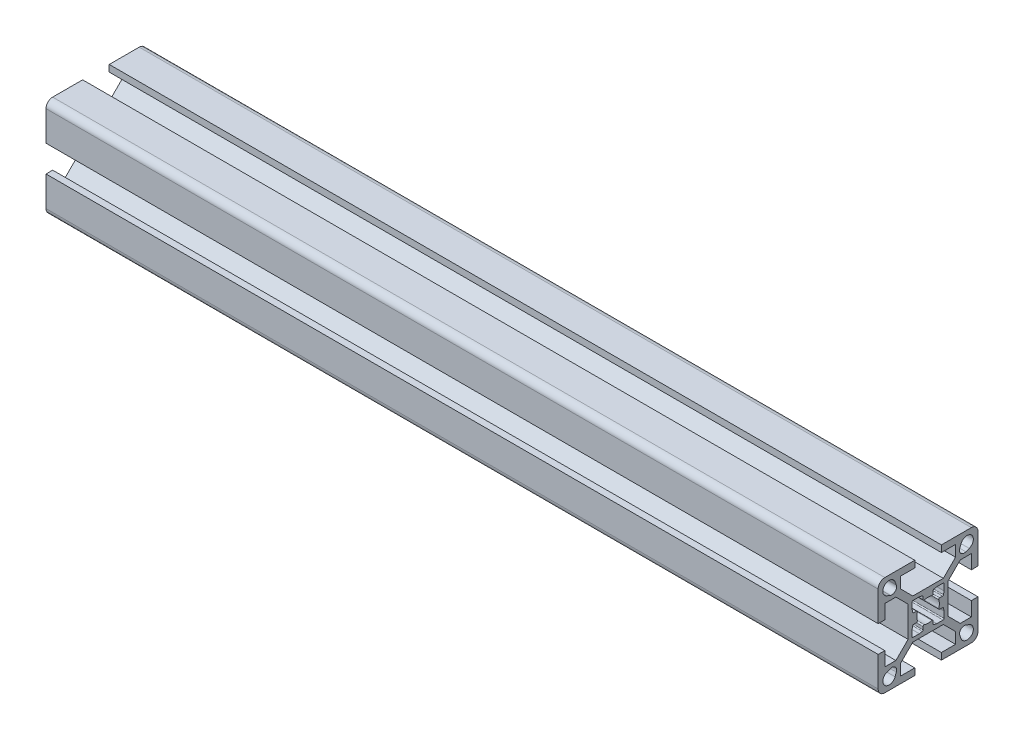
from build123d import *

# Parameters (mm, degrees)
BOSS_EXTRUDE1_DEPTH = 250


with BuildPart() as part:
    # Sketch1 → Boss-Extrude1 (new body)
    with BuildSketch(Plane(origin=(0, 0, 0), x_dir=(0, 0, -1), z_dir=(1, 0, 0))):
        with BuildLine():
            Line((-15, 13), (-15, 4))
            Line((-15, 4), (-13, 4))
            Line((-13, 4), (-13, 8.25))
            Line((-13, 8.25), (-9.664213562, 8.25))
            Line((-9.664213562, 8.25), (-6, 4.585786438))
            Line((-6, 4.585786438), (-6, -4.585786438))
            Line((-6, -4.585786438), (-9.664213562, -8.25))
            Line((-9.664213562, -8.25), (-13, -8.25))
            Line((-13, -8.25), (-13, -4))
            Line((-13, -4), (-15, -4))
            Line((-15, -4), (-15, -13))
            ThreePointArc((-15, -13), (-14.414213562, -14.414213562), (-13, -15))
            Line((-13, -15), (-4, -15))
            Line((-4, -15), (-4, -13))
            Line((-4, -13), (-8.25, -13))
            Line((-8.25, -13), (-8.25, -9.664213562))
            Line((-8.25, -9.664213562), (-4.585786438, -6))
            Line((-4.585786438, -6), (4.585786438, -6))
            Line((4.585786438, -6), (8.25, -9.664213562))
            Line((8.25, -9.664213562), (8.25, -13))
            Line((8.25, -13), (4, -13))
            Line((4, -13), (4, -15))
            Line((4, -15), (13, -15))
            ThreePointArc((13, -15), (14.414213562, -14.414213562), (15, -13))
            Line((15, -13), (15, -4))
            Line((15, -4), (13, -4))
            Line((13, -4), (13, -8.25))
            Line((13, -8.25), (9.664213562, -8.25))
            Line((9.664213562, -8.25), (6, -4.585786438))
            Line((6, -4.585786438), (6, 4.585786438))
            Line((6, 4.585786438), (9.664213562, 8.25))
            Line((9.664213562, 8.25), (13, 8.25))
            Line((13, 8.25), (13, 4))
            Line((13, 4), (15, 4))
            Line((15, 4), (15, 13))
            ThreePointArc((15, 13), (14.414213562, 14.414213562), (13, 15))
            Line((13, 15), (4, 15))
            Line((4, 15), (4, 13))
            Line((4, 13), (8.25, 13))
            Line((8.25, 13), (8.25, 9.664213562))
            Line((8.25, 9.664213562), (4.585786438, 6))
            Line((4.585786438, 6), (-4.585786438, 6))
            Line((-4.585786438, 6), (-8.25, 9.664213562))
            Line((-8.25, 9.664213562), (-8.25, 13))
            Line((-8.25, 13), (-4, 13))
            Line((-4, 13), (-4, 15))
            Line((-4, 15), (-13, 15))
            ThreePointArc((-13, 15), (-14.414213562, 14.414213562), (-15, 13))
        make_face()
        with BuildLine():
            Line((-9.539070071, 11.338915743), (-9.918883282, 12.361530981))
            ThreePointArc((-9.918883282, 12.361530981), (-13.043502884, 13.043502884), (-12.361530981, 9.918883282))
            Line((-12.361530981, 9.918883282), (-11.338915743, 9.539070071))
            ThreePointArc((-11.338915743, 9.539070071), (-9.861522369, 9.861522369), (-9.539070071, 11.338915743))
        make_face(mode=Mode.SUBTRACT)
        with BuildLine():
            Line((9.918883282, 12.361530981), (9.539070071, 11.338915743))
            ThreePointArc((9.539070071, 11.338915743), (9.861522369, 9.861522369), (11.338915743, 9.539070071))
            Line((11.338915743, 9.539070071), (12.361530981, 9.918883282))
            ThreePointArc((12.361530981, 9.918883282), (13.043502884, 13.043502884), (9.918883282, 12.361530981))
        make_face(mode=Mode.SUBTRACT)
        with BuildLine():
            Line((12.361530981, -9.918883282), (11.338915743, -9.539070071))
            ThreePointArc((11.338915743, -9.539070071), (9.861522369, -9.861522369), (9.539070071, -11.338915743))
            Line((9.539070071, -11.338915743), (9.918883282, -12.361530981))
            ThreePointArc((9.918883282, -12.361530981), (13.043502884, -13.043502884), (12.361530981, -9.918883282))
        make_face(mode=Mode.SUBTRACT)
        with BuildLine():
            Line((-11.338915743, -9.539070071), (-12.361530981, -9.918883282))
            ThreePointArc((-12.361530981, -9.918883282), (-13.043502884, -13.043502884), (-9.918883282, -12.361530981))
            Line((-9.918883282, -12.361530981), (-9.539070071, -11.338915743))
            ThreePointArc((-9.539070071, -11.338915743), (-9.861522369, -9.861522369), (-11.338915743, -9.539070071))
        make_face(mode=Mode.SUBTRACT)
        with BuildLine():
            Line((-4.8, -2.644433572), (-4.8, -4.5))
            ThreePointArc((-4.8, -4.5), (-4.712132034, -4.712132034), (-4.5, -4.8))
            Line((-4.5, -4.8), (-2.644433572, -4.8))
            ThreePointArc((-2.644433572, -4.8), (-2.615679847, -4.79861886), (-2.587190874, -4.794488155))
            Line((-2.587190874, -4.794488155), (-1.742757301, -4.630346896))
            ThreePointArc((-1.742757301, -4.630346896), (-1.568512625, -4.526682207), (-1.5, -4.335858741))
            Line((-1.5, -4.335858741), (-1.5, -3.5))
            ThreePointArc((-1.5, -3.5), (-1.374371458, -3.255879959), (-1.102702703, -3.216216216))
            ThreePointArc((-1.102702703, -3.216216216), (0, -3.4), (1.102702703, -3.216216216))
            ThreePointArc((1.102702703, -3.216216216), (1.374371458, -3.255879959), (1.5, -3.5))
            Line((1.5, -3.5), (1.5, -4.335858741))
            ThreePointArc((1.5, -4.335858741), (1.568512625, -4.526682207), (1.742757301, -4.630346896))
            Line((1.742757301, -4.630346896), (2.587190874, -4.794488155))
            ThreePointArc((2.587190874, -4.794488155), (2.615679847, -4.79861886), (2.644433572, -4.8))
            Line((2.644433572, -4.8), (4.5, -4.8))
            ThreePointArc((4.5, -4.8), (4.712132034, -4.712132034), (4.8, -4.5))
            Line((4.8, -4.5), (4.8, -2.644433572))
            ThreePointArc((4.8, -2.644433572), (4.79861886, -2.615679847), (4.794488155, -2.587190874))
            Line((4.794488155, -2.587190874), (4.630346896, -1.742757301))
            ThreePointArc((4.630346896, -1.742757301), (4.526682207, -1.568512625), (4.335858741, -1.5))
            Line((4.335858741, -1.5), (3.5, -1.5))
            ThreePointArc((3.5, -1.5), (3.255879959, -1.374371458), (3.216216216, -1.102702703))
            ThreePointArc((3.216216216, -1.102702703), (3.4, 0), (3.216216216, 1.102702703))
            ThreePointArc((3.216216216, 1.102702703), (3.255879959, 1.374371458), (3.5, 1.5))
            Line((3.5, 1.5), (4.335858741, 1.5))
            ThreePointArc((4.335858741, 1.5), (4.526682207, 1.568512625), (4.630346896, 1.742757301))
            Line((4.630346896, 1.742757301), (4.794488155, 2.587190874))
            ThreePointArc((4.794488155, 2.587190874), (4.79861886, 2.615679847), (4.8, 2.644433572))
            Line((4.8, 2.644433572), (4.8, 4.5))
            ThreePointArc((4.8, 4.5), (4.712132034, 4.712132034), (4.5, 4.8))
            Line((4.5, 4.8), (2.644433572, 4.8))
            ThreePointArc((2.644433572, 4.8), (2.615679847, 4.79861886), (2.587190874, 4.794488155))
            Line((2.587190874, 4.794488155), (1.742757301, 4.630346896))
            ThreePointArc((1.742757301, 4.630346896), (1.568512625, 4.526682207), (1.5, 4.335858741))
            Line((1.5, 4.335858741), (1.5, 3.5))
            ThreePointArc((1.5, 3.5), (1.374371458, 3.255879959), (1.102702703, 3.216216216))
            ThreePointArc((1.102702703, 3.216216216), (0, 3.4), (-1.102702703, 3.216216216))
            ThreePointArc((-1.102702703, 3.216216216), (-1.374371458, 3.255879959), (-1.5, 3.5))
            Line((-1.5, 3.5), (-1.5, 4.335858741))
            ThreePointArc((-1.5, 4.335858741), (-1.568512625, 4.526682207), (-1.742757301, 4.630346896))
            Line((-1.742757301, 4.630346896), (-2.587190874, 4.794488155))
            ThreePointArc((-2.587190874, 4.794488155), (-2.615679847, 4.79861886), (-2.644433572, 4.8))
            Line((-2.644433572, 4.8), (-4.5, 4.8))
            ThreePointArc((-4.5, 4.8), (-4.712132034, 4.712132034), (-4.8, 4.5))
            Line((-4.8, 4.5), (-4.8, 2.644433572))
            ThreePointArc((-4.8, 2.644433572), (-4.79861886, 2.615679847), (-4.794488155, 2.587190874))
            Line((-4.794488155, 2.587190874), (-4.630346896, 1.742757301))
            ThreePointArc((-4.630346896, 1.742757301), (-4.526682207, 1.568512625), (-4.335858741, 1.5))
            Line((-4.335858741, 1.5), (-3.5, 1.5))
            ThreePointArc((-3.5, 1.5), (-3.255879959, 1.374371458), (-3.216216216, 1.102702703))
            ThreePointArc((-3.216216216, 1.102702703), (-3.4, 0), (-3.216216216, -1.102702703))
            ThreePointArc((-3.216216216, -1.102702703), (-3.255879959, -1.374371458), (-3.5, -1.5))
            Line((-3.5, -1.5), (-4.335858741, -1.5))
            ThreePointArc((-4.335858741, -1.5), (-4.526682207, -1.568512625), (-4.630346896, -1.742757301))
            Line((-4.630346896, -1.742757301), (-4.794488155, -2.587190874))
            ThreePointArc((-4.794488155, -2.587190874), (-4.79861886, -2.615679847), (-4.8, -2.644433572))
        make_face(mode=Mode.SUBTRACT)
    extrude(amount=BOSS_EXTRUDE1_DEPTH)


solid = part.part
